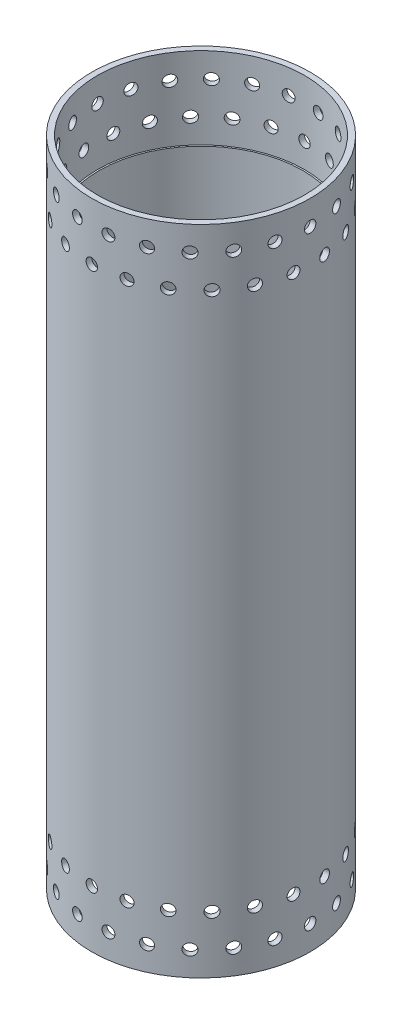
from build123d import *

# Parameters (mm, degrees)
SKETCH1_R                     = 67
SKETCH1_R_2                   = 62.5
BOSS_EXTRUDE1_DEPTH           = 400
CUT_EXTRUDE1_START            = -50
SKETCH2_R                     = 63.5
SKETCH2_R_2                   = 62.5
CUT_EXTRUDE1_DEPTH            = 50
F_7_0_7_DIAMETER_HOLE1_REACH  = 429.136
F_7_0_7_DIAMETER_HOLE1_BORE_R = 3.5
CIRPATTERN1_COUNT             = 22
F_7_0_7_DIAMETER_HOLE2_REACH  = 430.522
F_7_0_7_DIAMETER_HOLE2_BORE_R = 3.5
CIRPATTERN2_COUNT             = 22
MIRROR1_COPY_1_REACH          = 429.136
MIRROR1_COPY_1_SKETCH_R       = 3.5
MIRROR1_COPY_2_REACH          = 429.136
MIRROR1_COPY_2_SKETCH_R       = 3.5
MIRROR1_COPY_3_REACH          = 429.136
MIRROR1_COPY_3_SKETCH_R       = 3.5
MIRROR1_COPY_4_REACH          = 429.136
MIRROR1_COPY_4_SKETCH_R       = 3.5
MIRROR1_COPY_5_REACH          = 429.136
MIRROR1_COPY_5_SKETCH_R       = 3.5
MIRROR1_COPY_6_REACH          = 429.136
MIRROR1_COPY_6_SKETCH_R       = 3.5
MIRROR1_COPY_7_REACH          = 429.136
MIRROR1_COPY_7_SKETCH_R       = 3.5
MIRROR1_COPY_8_REACH          = 429.136
MIRROR1_COPY_8_SKETCH_R       = 3.5
MIRROR1_COPY_9_REACH          = 429.136
MIRROR1_COPY_9_SKETCH_R       = 3.5
MIRROR1_COPY_10_REACH         = 429.136
MIRROR1_COPY_10_SKETCH_R      = 3.5
MIRROR1_COPY_11_REACH         = 429.136
MIRROR1_COPY_11_SKETCH_R      = 3.5
MIRROR1_COPY_12_REACH         = 429.136
MIRROR1_COPY_12_SKETCH_R      = 3.5
MIRROR1_COPY_13_REACH         = 429.136
MIRROR1_COPY_13_SKETCH_R      = 3.5
MIRROR1_COPY_14_REACH         = 429.136
MIRROR1_COPY_14_SKETCH_R      = 3.5
MIRROR1_COPY_15_REACH         = 429.136
MIRROR1_COPY_15_SKETCH_R      = 3.5
MIRROR1_COPY_16_REACH         = 429.136
MIRROR1_COPY_16_SKETCH_R      = 3.5
MIRROR1_COPY_17_REACH         = 429.136
MIRROR1_COPY_17_SKETCH_R      = 3.5
MIRROR1_COPY_18_REACH         = 429.136
MIRROR1_COPY_18_SKETCH_R      = 3.5
MIRROR1_COPY_19_REACH         = 429.136
MIRROR1_COPY_19_SKETCH_R      = 3.5
MIRROR1_COPY_20_REACH         = 429.136
MIRROR1_COPY_20_SKETCH_R      = 3.5
MIRROR1_COPY_21_REACH         = 429.136
MIRROR1_COPY_21_SKETCH_R      = 3.5
MIRROR1_COPY_22_REACH         = 430.522
MIRROR1_COPY_22_SKETCH_R      = 3.5
MIRROR1_COPY_23_REACH         = 430.522
MIRROR1_COPY_23_SKETCH_R      = 3.5
MIRROR1_COPY_24_REACH         = 430.522
MIRROR1_COPY_24_SKETCH_R      = 3.5
MIRROR1_COPY_25_REACH         = 430.522
MIRROR1_COPY_25_SKETCH_R      = 3.5
MIRROR1_COPY_26_REACH         = 430.522
MIRROR1_COPY_26_SKETCH_R      = 3.5
MIRROR1_COPY_27_REACH         = 430.522
MIRROR1_COPY_27_SKETCH_R      = 3.5
MIRROR1_COPY_28_REACH         = 430.522
MIRROR1_COPY_28_SKETCH_R      = 3.5
MIRROR1_COPY_29_REACH         = 430.522
MIRROR1_COPY_29_SKETCH_R      = 3.5
MIRROR1_COPY_30_REACH         = 430.522
MIRROR1_COPY_30_SKETCH_R      = 3.5
MIRROR1_COPY_31_REACH         = 430.522
MIRROR1_COPY_31_SKETCH_R      = 3.5
MIRROR1_COPY_32_REACH         = 430.522
MIRROR1_COPY_32_SKETCH_R      = 3.5
MIRROR1_COPY_33_REACH         = 430.522
MIRROR1_COPY_33_SKETCH_R      = 3.5
MIRROR1_COPY_34_REACH         = 430.522
MIRROR1_COPY_34_SKETCH_R      = 3.5
MIRROR1_COPY_35_REACH         = 430.522
MIRROR1_COPY_35_SKETCH_R      = 3.5
MIRROR1_COPY_36_REACH         = 430.522
MIRROR1_COPY_36_SKETCH_R      = 3.5
MIRROR1_COPY_37_REACH         = 430.522
MIRROR1_COPY_37_SKETCH_R      = 3.5
MIRROR1_COPY_38_REACH         = 430.522
MIRROR1_COPY_38_SKETCH_R      = 3.5
MIRROR1_COPY_39_REACH         = 430.522
MIRROR1_COPY_39_SKETCH_R      = 3.5
MIRROR1_COPY_40_REACH         = 430.522
MIRROR1_COPY_40_SKETCH_R      = 3.5
MIRROR1_COPY_41_REACH         = 430.522
MIRROR1_COPY_41_SKETCH_R      = 3.5
MIRROR1_COPY_42_REACH         = 430.522
MIRROR1_COPY_42_SKETCH_R      = 3.5


with BuildPart() as part:
    # Sketch1 → Boss-Extrude1 (new body)
    with BuildSketch(Plane(origin=(0, 0, 0), x_dir=(1, 0, 0), z_dir=(0, 1, 0))):
        with Locations(Location((0, 0, 0), (0, 0, 270))):
            Circle(SKETCH1_R)
        with Locations(Location((0, 0, 0), (0, 0, 270))):
            Circle(SKETCH1_R_2, mode=Mode.SUBTRACT)
    extrude(amount=BOSS_EXTRUDE1_DEPTH)

    # Sketch2 → Cut-Extrude1 (cut)
    with BuildSketch(Plane(origin=(0, 400, 0), x_dir=(1, 0, 0), z_dir=(0, 1, 0)).offset(CUT_EXTRUDE1_START)):
        with Locations(Location((0, 0, 0), (0, 0, 270))):
            Circle(SKETCH2_R)
        with Locations(Location((0, 0, 0), (0, 0, 270))):
            Circle(SKETCH2_R_2, mode=Mode.SUBTRACT)
    cut_extrude1 = extrude(amount=CUT_EXTRUDE1_DEPTH, mode=Mode.SUBTRACT)

    # Ø7.0 (7) Diameter Hole1 bore → Ø7.0 (7) Diameter Hole1 (cut, up to next)
    with BuildSketch(Plane.ZY.offset(67), mode=Mode.PRIVATE) as f_7_0_7_diameter_hole1_sk1:
        with Locations((0, 385)):
            Circle(F_7_0_7_DIAMETER_HOLE1_BORE_R)
    f_7_0_7_diameter_hole1_tool1 = extrude(f_7_0_7_diameter_hole1_sk1.sketch, amount=-F_7_0_7_DIAMETER_HOLE1_REACH, mode=Mode.PRIVATE) & part.part
    f_7_0_7_diameter_hole1 = f_7_0_7_diameter_hole1_tool1.solids().sort_by_distance((-67, 385, 0))[0]
    add(f_7_0_7_diameter_hole1, mode=Mode.SUBTRACT)

    # CirPattern1: Ø7.0 (7) Diameter Hole1 ×22 about axis
    cirpattern1_axis = Axis((0, 400, 0), (0, -1, 0))
    for i in range(1, CIRPATTERN1_COUNT):
        add(f_7_0_7_diameter_hole1.rotate(cirpattern1_axis, i * 360 / CIRPATTERN1_COUNT), mode=Mode.SUBTRACT)

    # Ø7.0 (7) Diameter Hole2 bore → Ø7.0 (7) Diameter Hole2 (cut, up to next)
    with BuildSketch(Plane(origin=(66.318036606, 0, 9.535094162), x_dir=(0, -1, 0), z_dir=(0.9898214418854488, 0, 0.1423148382418752)), mode=Mode.PRIVATE) as f_7_0_7_diameter_hole2_sk1:
        with Locations((-365, 0)):
            Circle(F_7_0_7_DIAMETER_HOLE2_BORE_R)
    f_7_0_7_diameter_hole2_tool1 = extrude(f_7_0_7_diameter_hole2_sk1.sketch, amount=-F_7_0_7_DIAMETER_HOLE2_REACH, mode=Mode.PRIVATE) & part.part
    f_7_0_7_diameter_hole2 = f_7_0_7_diameter_hole2_tool1.solids().sort_by_distance((66.318037, 365, 9.535094))[0]
    add(f_7_0_7_diameter_hole2, mode=Mode.SUBTRACT)

    # CirPattern2: Ø7.0 (7) Diameter Hole2 ×22 about axis
    cirpattern2_axis = Axis((0, 400, 0), (0, -1, 0))
    for i in range(1, CIRPATTERN2_COUNT):
        add(f_7_0_7_diameter_hole2.rotate(cirpattern2_axis, i * 360 / CIRPATTERN2_COUNT), mode=Mode.SUBTRACT)

    # Mirror1: Cut-Extrude1, Ø7.0 (7) Diameter Hole1, Ø7.0 (7) Diameter Hole2 across plane
    add(cut_extrude1.mirror(Plane.ZX.offset(200)), mode=Mode.SUBTRACT)
    add(f_7_0_7_diameter_hole1.mirror(Plane.ZX.offset(200)), mode=Mode.SUBTRACT)
    add(f_7_0_7_diameter_hole2.mirror(Plane.ZX.offset(200)), mode=Mode.SUBTRACT)

    # Mirror1 copy 1 sketch → Mirror1 copy 1 (cut, up to next)
    with BuildSketch(Plane(origin=(-64.286029232, 400, -18.876081308), x_dir=(-0.28173255684142967, 0, 0.9594929736144974), z_dir=(-0.9594929736144974, 0, -0.28173255684142967)), mode=Mode.PRIVATE) as mirror1_copy_1_sk1:
        with Locations((0, -385)):
            Circle(MIRROR1_COPY_1_SKETCH_R)
    mirror1_copy_1_tool1 = extrude(mirror1_copy_1_sk1.sketch, amount=-MIRROR1_COPY_1_REACH, mode=Mode.PRIVATE) & part.part
    add(mirror1_copy_1_tool1.solids().sort_by_distance((-64.286029232, 15, -18.876081308))[0], mode=Mode.SUBTRACT)

    # Mirror1 copy 2 sketch → Mirror1 copy 2 (cut, up to next)
    with BuildSketch(Plane(origin=(-56.3639867, 400, -36.22293477), x_dir=(-0.5406408174555976, 0, 0.8412535328311812), z_dir=(-0.8412535328311812, 0, -0.5406408174555976)), mode=Mode.PRIVATE) as mirror1_copy_2_sk1:
        with Locations((0, -385)):
            Circle(MIRROR1_COPY_2_SKETCH_R)
    mirror1_copy_2_tool1 = extrude(mirror1_copy_2_sk1.sketch, amount=-MIRROR1_COPY_2_REACH, mode=Mode.PRIVATE) & part.part
    add(mirror1_copy_2_tool1.solids().sort_by_distance((-56.3639867, 15, -36.22293477))[0], mode=Mode.SUBTRACT)

    # Mirror1 copy 3 sketch → Mirror1 copy 3 (cut, up to next)
    with BuildSketch(Plane(origin=(-43.875669174, 400, -50.635221482), x_dir=(-0.7557495743542583, 0, 0.654860733945285), z_dir=(-0.654860733945285, 0, -0.7557495743542583)), mode=Mode.PRIVATE) as mirror1_copy_3_sk1:
        with Locations((0, -385)):
            Circle(MIRROR1_COPY_3_SKETCH_R)
    mirror1_copy_3_tool1 = extrude(mirror1_copy_3_sk1.sketch, amount=-MIRROR1_COPY_3_REACH, mode=Mode.PRIVATE) & part.part
    add(mirror1_copy_3_tool1.solids().sort_by_distance((-43.875669174, 15, -50.635221482))[0], mode=Mode.SUBTRACT)

    # Mirror1 copy 4 sketch → Mirror1 copy 4 (cut, up to next)
    with BuildSketch(Plane(origin=(-27.832805871, 400, -60.945343689), x_dir=(-0.9096319953545183, 0, 0.41541501300188644), z_dir=(-0.41541501300188644, 0, -0.9096319953545183)), mode=Mode.PRIVATE) as mirror1_copy_4_sk1:
        with Locations((0, -385)):
            Circle(MIRROR1_COPY_4_SKETCH_R)
    mirror1_copy_4_tool1 = extrude(mirror1_copy_4_sk1.sketch, amount=-MIRROR1_COPY_4_REACH, mode=Mode.PRIVATE) & part.part
    add(mirror1_copy_4_tool1.solids().sort_by_distance((-27.832805871, 15, -60.945343689))[0], mode=Mode.SUBTRACT)

    # Mirror1 copy 5 sketch → Mirror1 copy 5 (cut, up to next)
    with BuildSketch(Plane(origin=(-9.535094164, 400, -66.318036606), x_dir=(-0.9898214418809327, 0, 0.14231483827328534), z_dir=(-0.14231483827328534, 0, -0.9898214418809327)), mode=Mode.PRIVATE) as mirror1_copy_5_sk1:
        with Locations((0, -385)):
            Circle(MIRROR1_COPY_5_SKETCH_R)
    mirror1_copy_5_tool1 = extrude(mirror1_copy_5_sk1.sketch, amount=-MIRROR1_COPY_5_REACH, mode=Mode.PRIVATE) & part.part
    add(mirror1_copy_5_tool1.solids().sort_by_distance((-9.535094164, 15, -66.318036606))[0], mode=Mode.SUBTRACT)

    # Mirror1 copy 6 sketch → Mirror1 copy 6 (cut, up to next)
    with BuildSketch(Plane(origin=(9.535094164, 400, -66.318036606), x_dir=(-0.9898214418809327, 0, -0.14231483827328523), z_dir=(0.14231483827328523, 0, -0.9898214418809327)), mode=Mode.PRIVATE) as mirror1_copy_6_sk1:
        with Locations((0, -385)):
            Circle(MIRROR1_COPY_6_SKETCH_R)
    mirror1_copy_6_tool1 = extrude(mirror1_copy_6_sk1.sketch, amount=-MIRROR1_COPY_6_REACH, mode=Mode.PRIVATE) & part.part
    add(mirror1_copy_6_tool1.solids().sort_by_distance((9.535094164, 15, -66.318036606))[0], mode=Mode.SUBTRACT)

    # Mirror1 copy 7 sketch → Mirror1 copy 7 (cut, up to next)
    with BuildSketch(Plane(origin=(27.832805871, 400, -60.945343689), x_dir=(-0.9096319953545184, 0, -0.4154150130018863), z_dir=(0.4154150130018863, 0, -0.9096319953545184)), mode=Mode.PRIVATE) as mirror1_copy_7_sk1:
        with Locations((0, -385)):
            Circle(MIRROR1_COPY_7_SKETCH_R)
    mirror1_copy_7_tool1 = extrude(mirror1_copy_7_sk1.sketch, amount=-MIRROR1_COPY_7_REACH, mode=Mode.PRIVATE) & part.part
    add(mirror1_copy_7_tool1.solids().sort_by_distance((27.832805871, 15, -60.945343689))[0], mode=Mode.SUBTRACT)

    # Mirror1 copy 8 sketch → Mirror1 copy 8 (cut, up to next)
    with BuildSketch(Plane(origin=(43.875669174, 400, -50.635221482), x_dir=(-0.7557495743542583, 0, -0.654860733945285), z_dir=(0.654860733945285, 0, -0.7557495743542583)), mode=Mode.PRIVATE) as mirror1_copy_8_sk1:
        with Locations((0, -385)):
            Circle(MIRROR1_COPY_8_SKETCH_R)
    mirror1_copy_8_tool1 = extrude(mirror1_copy_8_sk1.sketch, amount=-MIRROR1_COPY_8_REACH, mode=Mode.PRIVATE) & part.part
    add(mirror1_copy_8_tool1.solids().sort_by_distance((43.875669174, 15, -50.635221482))[0], mode=Mode.SUBTRACT)

    # Mirror1 copy 9 sketch → Mirror1 copy 9 (cut, up to next)
    with BuildSketch(Plane(origin=(56.3639867, 400, -36.22293477), x_dir=(-0.5406408174555974, 0, -0.8412535328311813), z_dir=(0.8412535328311813, 0, -0.5406408174555974)), mode=Mode.PRIVATE) as mirror1_copy_9_sk1:
        with Locations((0, -385)):
            Circle(MIRROR1_COPY_9_SKETCH_R)
    mirror1_copy_9_tool1 = extrude(mirror1_copy_9_sk1.sketch, amount=-MIRROR1_COPY_9_REACH, mode=Mode.PRIVATE) & part.part
    add(mirror1_copy_9_tool1.solids().sort_by_distance((56.3639867, 15, -36.22293477))[0], mode=Mode.SUBTRACT)

    # Mirror1 copy 10 sketch → Mirror1 copy 10 (cut, up to next)
    with BuildSketch(Plane(origin=(64.286029232, 400, -18.876081308), x_dir=(-0.28173255684143006, 0, -0.9594929736144973), z_dir=(0.9594929736144973, 0, -0.28173255684143006)), mode=Mode.PRIVATE) as mirror1_copy_10_sk1:
        with Locations((0, -385)):
            Circle(MIRROR1_COPY_10_SKETCH_R)
    mirror1_copy_10_tool1 = extrude(mirror1_copy_10_sk1.sketch, amount=-MIRROR1_COPY_10_REACH, mode=Mode.PRIVATE) & part.part
    add(mirror1_copy_10_tool1.solids().sort_by_distance((64.286029232, 15, -18.876081308))[0], mode=Mode.SUBTRACT)

    # Mirror1 copy 11 sketch → Mirror1 copy 11 (cut, up to next)
    with BuildSketch(Plane(origin=(67, 400, 0), x_dir=(0, 0, -1), z_dir=(1, 0, 0)), mode=Mode.PRIVATE) as mirror1_copy_11_sk1:
        with Locations((0, -385)):
            Circle(MIRROR1_COPY_11_SKETCH_R)
    mirror1_copy_11_tool1 = extrude(mirror1_copy_11_sk1.sketch, amount=-MIRROR1_COPY_11_REACH, mode=Mode.PRIVATE) & part.part
    add(mirror1_copy_11_tool1.solids().sort_by_distance((67, 15, 0))[0], mode=Mode.SUBTRACT)

    # Mirror1 copy 12 sketch → Mirror1 copy 12 (cut, up to next)
    with BuildSketch(Plane(origin=(64.286029232, 400, 18.876081308), x_dir=(0.28173255684142984, 0, -0.9594929736144974), z_dir=(0.9594929736144974, 0, 0.28173255684142984)), mode=Mode.PRIVATE) as mirror1_copy_12_sk1:
        with Locations((0, -385)):
            Circle(MIRROR1_COPY_12_SKETCH_R)
    mirror1_copy_12_tool1 = extrude(mirror1_copy_12_sk1.sketch, amount=-MIRROR1_COPY_12_REACH, mode=Mode.PRIVATE) & part.part
    add(mirror1_copy_12_tool1.solids().sort_by_distance((64.286029232, 15, 18.876081308))[0], mode=Mode.SUBTRACT)

    # Mirror1 copy 13 sketch → Mirror1 copy 13 (cut, up to next)
    with BuildSketch(Plane(origin=(56.3639867, 400, 36.22293477), x_dir=(0.5406408174555976, 0, -0.8412535328311812), z_dir=(0.8412535328311812, 0, 0.5406408174555976)), mode=Mode.PRIVATE) as mirror1_copy_13_sk1:
        with Locations((0, -385)):
            Circle(MIRROR1_COPY_13_SKETCH_R)
    mirror1_copy_13_tool1 = extrude(mirror1_copy_13_sk1.sketch, amount=-MIRROR1_COPY_13_REACH, mode=Mode.PRIVATE) & part.part
    add(mirror1_copy_13_tool1.solids().sort_by_distance((56.3639867, 15, 36.22293477))[0], mode=Mode.SUBTRACT)

    # Mirror1 copy 14 sketch → Mirror1 copy 14 (cut, up to next)
    with BuildSketch(Plane(origin=(43.875669174, 400, 50.635221482), x_dir=(0.7557495743542582, 0, -0.6548607339452852), z_dir=(0.6548607339452852, 0, 0.7557495743542582)), mode=Mode.PRIVATE) as mirror1_copy_14_sk1:
        with Locations((0, -385)):
            Circle(MIRROR1_COPY_14_SKETCH_R)
    mirror1_copy_14_tool1 = extrude(mirror1_copy_14_sk1.sketch, amount=-MIRROR1_COPY_14_REACH, mode=Mode.PRIVATE) & part.part
    add(mirror1_copy_14_tool1.solids().sort_by_distance((43.875669174, 15, 50.635221482))[0], mode=Mode.SUBTRACT)

    # Mirror1 copy 15 sketch → Mirror1 copy 15 (cut, up to next)
    with BuildSketch(Plane(origin=(27.832805871, 400, 60.945343689), x_dir=(0.9096319953545184, 0, -0.4154150130018864), z_dir=(0.4154150130018864, 0, 0.9096319953545184)), mode=Mode.PRIVATE) as mirror1_copy_15_sk1:
        with Locations((0, -385)):
            Circle(MIRROR1_COPY_15_SKETCH_R)
    mirror1_copy_15_tool1 = extrude(mirror1_copy_15_sk1.sketch, amount=-MIRROR1_COPY_15_REACH, mode=Mode.PRIVATE) & part.part
    add(mirror1_copy_15_tool1.solids().sort_by_distance((27.832805871, 15, 60.945343689))[0], mode=Mode.SUBTRACT)

    # Mirror1 copy 16 sketch → Mirror1 copy 16 (cut, up to next)
    with BuildSketch(Plane(origin=(9.535094164, 400, 66.318036606), x_dir=(0.9898214418809327, 0, -0.14231483827328523), z_dir=(0.14231483827328523, 0, 0.9898214418809327)), mode=Mode.PRIVATE) as mirror1_copy_16_sk1:
        with Locations((0, -385)):
            Circle(MIRROR1_COPY_16_SKETCH_R)
    mirror1_copy_16_tool1 = extrude(mirror1_copy_16_sk1.sketch, amount=-MIRROR1_COPY_16_REACH, mode=Mode.PRIVATE) & part.part
    add(mirror1_copy_16_tool1.solids().sort_by_distance((9.535094164, 15, 66.318036606))[0], mode=Mode.SUBTRACT)

    # Mirror1 copy 17 sketch → Mirror1 copy 17 (cut, up to next)
    with BuildSketch(Plane(origin=(-9.535094164, 400, 66.318036606), x_dir=(0.9898214418809328, 0, 0.14231483827328487), z_dir=(-0.14231483827328487, 0, 0.9898214418809328)), mode=Mode.PRIVATE) as mirror1_copy_17_sk1:
        with Locations((0, -385)):
            Circle(MIRROR1_COPY_17_SKETCH_R)
    mirror1_copy_17_tool1 = extrude(mirror1_copy_17_sk1.sketch, amount=-MIRROR1_COPY_17_REACH, mode=Mode.PRIVATE) & part.part
    add(mirror1_copy_17_tool1.solids().sort_by_distance((-9.535094164, 15, 66.318036606))[0], mode=Mode.SUBTRACT)

    # Mirror1 copy 18 sketch → Mirror1 copy 18 (cut, up to next)
    with BuildSketch(Plane(origin=(-27.832805871, 400, 60.945343689), x_dir=(0.9096319953545182, 0, 0.4154150130018868), z_dir=(-0.4154150130018868, 0, 0.9096319953545182)), mode=Mode.PRIVATE) as mirror1_copy_18_sk1:
        with Locations((0, -385)):
            Circle(MIRROR1_COPY_18_SKETCH_R)
    mirror1_copy_18_tool1 = extrude(mirror1_copy_18_sk1.sketch, amount=-MIRROR1_COPY_18_REACH, mode=Mode.PRIVATE) & part.part
    add(mirror1_copy_18_tool1.solids().sort_by_distance((-27.832805871, 15, 60.945343689))[0], mode=Mode.SUBTRACT)

    # Mirror1 copy 19 sketch → Mirror1 copy 19 (cut, up to next)
    with BuildSketch(Plane(origin=(-43.875669174, 400, 50.635221482), x_dir=(0.7557495743542587, 0, 0.6548607339452845), z_dir=(-0.6548607339452845, 0, 0.7557495743542587)), mode=Mode.PRIVATE) as mirror1_copy_19_sk1:
        with Locations((0, -385)):
            Circle(MIRROR1_COPY_19_SKETCH_R)
    mirror1_copy_19_tool1 = extrude(mirror1_copy_19_sk1.sketch, amount=-MIRROR1_COPY_19_REACH, mode=Mode.PRIVATE) & part.part
    add(mirror1_copy_19_tool1.solids().sort_by_distance((-43.875669174, 15, 50.635221482))[0], mode=Mode.SUBTRACT)

    # Mirror1 copy 20 sketch → Mirror1 copy 20 (cut, up to next)
    with BuildSketch(Plane(origin=(-56.3639867, 400, 36.22293477), x_dir=(0.5406408174555982, 0, 0.8412535328311808), z_dir=(-0.8412535328311808, 0, 0.5406408174555982)), mode=Mode.PRIVATE) as mirror1_copy_20_sk1:
        with Locations((0, -385)):
            Circle(MIRROR1_COPY_20_SKETCH_R)
    mirror1_copy_20_tool1 = extrude(mirror1_copy_20_sk1.sketch, amount=-MIRROR1_COPY_20_REACH, mode=Mode.PRIVATE) & part.part
    add(mirror1_copy_20_tool1.solids().sort_by_distance((-56.3639867, 15, 36.22293477))[0], mode=Mode.SUBTRACT)

    # Mirror1 copy 21 sketch → Mirror1 copy 21 (cut, up to next)
    with BuildSketch(Plane(origin=(-64.286029232, 400, 18.876081308), x_dir=(0.2817325568414298, 0, 0.9594929736144974), z_dir=(-0.9594929736144974, 0, 0.2817325568414298)), mode=Mode.PRIVATE) as mirror1_copy_21_sk1:
        with Locations((0, -385)):
            Circle(MIRROR1_COPY_21_SKETCH_R)
    mirror1_copy_21_tool1 = extrude(mirror1_copy_21_sk1.sketch, amount=-MIRROR1_COPY_21_REACH, mode=Mode.PRIVATE) & part.part
    add(mirror1_copy_21_tool1.solids().sort_by_distance((-64.286029232, 15, 18.876081308))[0], mode=Mode.SUBTRACT)

    # Mirror1 copy 22 sketch → Mirror1 copy 22 (cut, up to next)
    with BuildSketch(Plane(origin=(60.94534369, 400, 27.832805869), x_dir=(0, 1, 0), z_dir=(0.9096319953677008, 0, 0.4154150129730212)), mode=Mode.PRIVATE) as mirror1_copy_22_sk1:
        with Locations((-365, 0)):
            Circle(MIRROR1_COPY_22_SKETCH_R)
    mirror1_copy_22_tool1 = extrude(mirror1_copy_22_sk1.sketch, amount=-MIRROR1_COPY_22_REACH, mode=Mode.PRIVATE) & part.part
    add(mirror1_copy_22_tool1.solids().sort_by_distance((60.945344113, 35, 27.832805824))[0], mode=Mode.SUBTRACT)

    # Mirror1 copy 23 sketch → Mirror1 copy 23 (cut, up to next)
    with BuildSketch(Plane(origin=(50.635221483, 400, 43.875669173), x_dir=(0, 1, 0), z_dir=(0.7557495743750391, 0, 0.654860733921303)), mode=Mode.PRIVATE) as mirror1_copy_23_sk1:
        with Locations((-365, 0)):
            Circle(MIRROR1_COPY_23_SKETCH_R)
    mirror1_copy_23_tool1 = extrude(mirror1_copy_23_sk1.sketch, amount=-MIRROR1_COPY_23_REACH, mode=Mode.PRIVATE) & part.part
    add(mirror1_copy_23_tool1.solids().sort_by_distance((50.635221902, 35, 43.875669249))[0], mode=Mode.SUBTRACT)

    # Mirror1 copy 24 sketch → Mirror1 copy 24 (cut, up to next)
    with BuildSketch(Plane(origin=(36.222934771, 400, 56.363986699), x_dir=(0, 1, 0), z_dir=(0.540640817482293, 0, 0.841253532814025)), mode=Mode.PRIVATE) as mirror1_copy_24_sk1:
        with Locations((-365, 0)):
            Circle(MIRROR1_COPY_24_SKETCH_R)
    mirror1_copy_24_tool1 = extrude(mirror1_copy_24_sk1.sketch, amount=-MIRROR1_COPY_24_REACH, mode=Mode.PRIVATE) & part.part
    add(mirror1_copy_24_tool1.solids().sort_by_distance((36.222935152, 35, 56.36398689))[0], mode=Mode.SUBTRACT)

    # Mirror1 copy 25 sketch → Mirror1 copy 25 (cut, up to next)
    with BuildSketch(Plane(origin=(18.87608131, 400, 64.286029232), x_dir=(0, 1, 0), z_dir=(0.28173255687187726, 0, 0.9594929736055572)), mode=Mode.PRIVATE) as mirror1_copy_25_sk1:
        with Locations((-365, 0)):
            Circle(MIRROR1_COPY_25_SKETCH_R)
    mirror1_copy_25_tool1 = extrude(mirror1_copy_25_sk1.sketch, amount=-MIRROR1_COPY_25_REACH, mode=Mode.PRIVATE) & part.part
    add(mirror1_copy_25_tool1.solids().sort_by_distance((18.876081622, 35, 64.286029522))[0], mode=Mode.SUBTRACT)

    # Mirror1 copy 26 sketch → Mirror1 copy 26 (cut, up to next)
    with BuildSketch(Plane(origin=(2e-09, 400, 67), x_dir=(0, 1, 0), z_dir=(3.1733143890377846e-11, 0, 1.0)), mode=Mode.PRIVATE) as mirror1_copy_26_sk1:
        with Locations((-365, 0)):
            Circle(MIRROR1_COPY_26_SKETCH_R)
    mirror1_copy_26_tool1 = extrude(mirror1_copy_26_sk1.sketch, amount=-MIRROR1_COPY_26_REACH, mode=Mode.PRIVATE) & part.part
    add(mirror1_copy_26_tool1.solids().sort_by_distance((2.19e-07, 35, 67.000000367))[0], mode=Mode.SUBTRACT)

    # Mirror1 copy 27 sketch → Mirror1 copy 27 (cut, up to next)
    with BuildSketch(Plane(origin=(-18.876081306, 400, 64.286029233), x_dir=(0, 1, 0), z_dir=(-0.2817325568109823, 0, 0.9594929736234377)), mode=Mode.PRIVATE) as mirror1_copy_27_sk1:
        with Locations((-365, 0)):
            Circle(MIRROR1_COPY_27_SKETCH_R)
    mirror1_copy_27_tool1 = extrude(mirror1_copy_27_sk1.sketch, amount=-MIRROR1_COPY_27_REACH, mode=Mode.PRIVATE) & part.part
    add(mirror1_copy_27_tool1.solids().sort_by_distance((-18.876081202, 35, 64.286029646))[0], mode=Mode.SUBTRACT)

    # Mirror1 copy 28 sketch → Mirror1 copy 28 (cut, up to next)
    with BuildSketch(Plane(origin=(-36.222934768, 400, 56.363986701), x_dir=(0, 1, 0), z_dir=(-0.540640817428902, 0, 0.8412535328483375)), mode=Mode.PRIVATE) as mirror1_copy_28_sk1:
        with Locations((-365, 0)):
            Circle(MIRROR1_COPY_28_SKETCH_R)
    mirror1_copy_28_tool1 = extrude(mirror1_copy_28_sk1.sketch, amount=-MIRROR1_COPY_28_REACH, mode=Mode.PRIVATE) & part.part
    add(mirror1_copy_28_tool1.solids().sort_by_distance((-36.222934784, 35, 56.363987126))[0], mode=Mode.SUBTRACT)

    # Mirror1 copy 29 sketch → Mirror1 copy 29 (cut, up to next)
    with BuildSketch(Plane(origin=(-50.63522148, 400, 43.875669176), x_dir=(0, 1, 0), z_dir=(-0.7557495743334777, 0, 0.6548607339692673)), mode=Mode.PRIVATE) as mirror1_copy_29_sk1:
        with Locations((-365, 0)):
            Circle(MIRROR1_COPY_29_SKETCH_R)
    mirror1_copy_29_tool1 = extrude(mirror1_copy_29_sk1.sketch, amount=-MIRROR1_COPY_29_REACH, mode=Mode.PRIVATE) & part.part
    add(mirror1_copy_29_tool1.solids().sort_by_distance((-50.635221616, 35, 43.87566958))[0], mode=Mode.SUBTRACT)

    # Mirror1 copy 30 sketch → Mirror1 copy 30 (cut, up to next)
    with BuildSketch(Plane(origin=(-60.945343688, 400, 27.832805873), x_dir=(0, 1, 0), z_dir=(-0.9096319953413362, 0, 0.4154150130307516)), mode=Mode.PRIVATE) as mirror1_copy_30_sk1:
        with Locations((-365, 0)):
            Circle(MIRROR1_COPY_30_SKETCH_R)
    mirror1_copy_30_tool1 = extrude(mirror1_copy_30_sk1.sketch, amount=-MIRROR1_COPY_30_REACH, mode=Mode.PRIVATE) & part.part
    add(mirror1_copy_30_tool1.solids().sort_by_distance((-60.945343931, 35, 27.832806222))[0], mode=Mode.SUBTRACT)

    # Mirror1 copy 31 sketch → Mirror1 copy 31 (cut, up to next)
    with BuildSketch(Plane(origin=(-66.318036606, 400, 9.535094166), x_dir=(0, 1, 0), z_dir=(-0.9898214418764166, 0, 0.14231483830469543)), mode=Mode.PRIVATE) as mirror1_copy_31_sk1:
        with Locations((-365, 0)):
            Circle(MIRROR1_COPY_31_SKETCH_R)
    mirror1_copy_31_tool1 = extrude(mirror1_copy_31_sk1.sketch, amount=-MIRROR1_COPY_31_REACH, mode=Mode.PRIVATE) & part.part
    add(mirror1_copy_31_tool1.solids().sort_by_distance((-66.318036938, 35, 9.535094433))[0], mode=Mode.SUBTRACT)

    # Mirror1 copy 32 sketch → Mirror1 copy 32 (cut, up to next)
    with BuildSketch(Plane(origin=(-66.318036606, 400, -9.535094162), x_dir=(0, 1, 0), z_dir=(-0.9898214418854488, 0, -0.1423148382418751)), mode=Mode.PRIVATE) as mirror1_copy_32_sk1:
        with Locations((-365, 0)):
            Circle(MIRROR1_COPY_32_SKETCH_R)
    mirror1_copy_32_tool1 = extrude(mirror1_copy_32_sk1.sketch, amount=-MIRROR1_COPY_32_REACH, mode=Mode.PRIVATE) & part.part
    add(mirror1_copy_32_tool1.solids().sort_by_distance((-66.318037, 35, -9.535094))[0], mode=Mode.SUBTRACT)

    # Mirror1 copy 33 sketch → Mirror1 copy 33 (cut, up to next)
    with BuildSketch(Plane(origin=(-60.94534369, 400, -27.832805869), x_dir=(0, 1, 0), z_dir=(-0.9096319953677007, 0, -0.4154150129730213)), mode=Mode.PRIVATE) as mirror1_copy_33_sk1:
        with Locations((-365, 0)):
            Circle(MIRROR1_COPY_33_SKETCH_R)
    mirror1_copy_33_tool1 = extrude(mirror1_copy_33_sk1.sketch, amount=-MIRROR1_COPY_33_REACH, mode=Mode.PRIVATE) & part.part
    add(mirror1_copy_33_tool1.solids().sort_by_distance((-60.945344113, 35, -27.832805824))[0], mode=Mode.SUBTRACT)

    # Mirror1 copy 34 sketch → Mirror1 copy 34 (cut, up to next)
    with BuildSketch(Plane(origin=(-50.635221483, 400, -43.875669173), x_dir=(0, 1, 0), z_dir=(-0.7557495743750391, 0, -0.654860733921303)), mode=Mode.PRIVATE) as mirror1_copy_34_sk1:
        with Locations((-365, 0)):
            Circle(MIRROR1_COPY_34_SKETCH_R)
    mirror1_copy_34_tool1 = extrude(mirror1_copy_34_sk1.sketch, amount=-MIRROR1_COPY_34_REACH, mode=Mode.PRIVATE) & part.part
    add(mirror1_copy_34_tool1.solids().sort_by_distance((-50.635221902, 35, -43.875669249))[0], mode=Mode.SUBTRACT)

    # Mirror1 copy 35 sketch → Mirror1 copy 35 (cut, up to next)
    with BuildSketch(Plane(origin=(-36.222934771, 400, -56.363986699), x_dir=(0, 1, 0), z_dir=(-0.5406408174822932, 0, -0.8412535328140249)), mode=Mode.PRIVATE) as mirror1_copy_35_sk1:
        with Locations((-365, 0)):
            Circle(MIRROR1_COPY_35_SKETCH_R)
    mirror1_copy_35_tool1 = extrude(mirror1_copy_35_sk1.sketch, amount=-MIRROR1_COPY_35_REACH, mode=Mode.PRIVATE) & part.part
    add(mirror1_copy_35_tool1.solids().sort_by_distance((-36.222935152, 35, -56.36398689))[0], mode=Mode.SUBTRACT)

    # Mirror1 copy 36 sketch → Mirror1 copy 36 (cut, up to next)
    with BuildSketch(Plane(origin=(-18.87608131, 400, -64.286029232), x_dir=(0, 1, 0), z_dir=(-0.28173255687187715, 0, -0.9594929736055573)), mode=Mode.PRIVATE) as mirror1_copy_36_sk1:
        with Locations((-365, 0)):
            Circle(MIRROR1_COPY_36_SKETCH_R)
    mirror1_copy_36_tool1 = extrude(mirror1_copy_36_sk1.sketch, amount=-MIRROR1_COPY_36_REACH, mode=Mode.PRIVATE) & part.part
    add(mirror1_copy_36_tool1.solids().sort_by_distance((-18.876081622, 35, -64.286029522))[0], mode=Mode.SUBTRACT)

    # Mirror1 copy 37 sketch → Mirror1 copy 37 (cut, up to next)
    with BuildSketch(Plane(origin=(-2e-09, 400, -67), x_dir=(0, 1, 0), z_dir=(-3.1733032868075384e-11, 0, -1.0)), mode=Mode.PRIVATE) as mirror1_copy_37_sk1:
        with Locations((-365, 0)):
            Circle(MIRROR1_COPY_37_SKETCH_R)
    mirror1_copy_37_tool1 = extrude(mirror1_copy_37_sk1.sketch, amount=-MIRROR1_COPY_37_REACH, mode=Mode.PRIVATE) & part.part
    add(mirror1_copy_37_tool1.solids().sort_by_distance((-2.19e-07, 35, -67.000000367))[0], mode=Mode.SUBTRACT)

    # Mirror1 copy 38 sketch → Mirror1 copy 38 (cut, up to next)
    with BuildSketch(Plane(origin=(18.876081306, 400, -64.286029233), x_dir=(0, 1, 0), z_dir=(0.28173255681098197, 0, -0.9594929736234378)), mode=Mode.PRIVATE) as mirror1_copy_38_sk1:
        with Locations((-365, 0)):
            Circle(MIRROR1_COPY_38_SKETCH_R)
    mirror1_copy_38_tool1 = extrude(mirror1_copy_38_sk1.sketch, amount=-MIRROR1_COPY_38_REACH, mode=Mode.PRIVATE) & part.part
    add(mirror1_copy_38_tool1.solids().sort_by_distance((18.876081202, 35, -64.286029646))[0], mode=Mode.SUBTRACT)

    # Mirror1 copy 39 sketch → Mirror1 copy 39 (cut, up to next)
    with BuildSketch(Plane(origin=(36.222934768, 400, -56.363986701), x_dir=(0, 1, 0), z_dir=(0.5406408174289026, 0, -0.8412535328483371)), mode=Mode.PRIVATE) as mirror1_copy_39_sk1:
        with Locations((-365, 0)):
            Circle(MIRROR1_COPY_39_SKETCH_R)
    mirror1_copy_39_tool1 = extrude(mirror1_copy_39_sk1.sketch, amount=-MIRROR1_COPY_39_REACH, mode=Mode.PRIVATE) & part.part
    add(mirror1_copy_39_tool1.solids().sort_by_distance((36.222934784, 35, -56.363987126))[0], mode=Mode.SUBTRACT)

    # Mirror1 copy 40 sketch → Mirror1 copy 40 (cut, up to next)
    with BuildSketch(Plane(origin=(50.63522148, 400, -43.875669176), x_dir=(0, 1, 0), z_dir=(0.7557495743334772, 0, -0.6548607339692677)), mode=Mode.PRIVATE) as mirror1_copy_40_sk1:
        with Locations((-365, 0)):
            Circle(MIRROR1_COPY_40_SKETCH_R)
    mirror1_copy_40_tool1 = extrude(mirror1_copy_40_sk1.sketch, amount=-MIRROR1_COPY_40_REACH, mode=Mode.PRIVATE) & part.part
    add(mirror1_copy_40_tool1.solids().sort_by_distance((50.635221616, 35, -43.87566958))[0], mode=Mode.SUBTRACT)

    # Mirror1 copy 41 sketch → Mirror1 copy 41 (cut, up to next)
    with BuildSketch(Plane(origin=(60.945343688, 400, -27.832805873), x_dir=(0, 1, 0), z_dir=(0.9096319953413358, 0, -0.41541501303075234)), mode=Mode.PRIVATE) as mirror1_copy_41_sk1:
        with Locations((-365, 0)):
            Circle(MIRROR1_COPY_41_SKETCH_R)
    mirror1_copy_41_tool1 = extrude(mirror1_copy_41_sk1.sketch, amount=-MIRROR1_COPY_41_REACH, mode=Mode.PRIVATE) & part.part
    add(mirror1_copy_41_tool1.solids().sort_by_distance((60.945343931, 35, -27.832806222))[0], mode=Mode.SUBTRACT)

    # Mirror1 copy 42 sketch → Mirror1 copy 42 (cut, up to next)
    with BuildSketch(Plane(origin=(66.318036606, 400, -9.535094166), x_dir=(0, 1, 0), z_dir=(0.9898214418764167, 0, -0.14231483830469518)), mode=Mode.PRIVATE) as mirror1_copy_42_sk1:
        with Locations((-365, 0)):
            Circle(MIRROR1_COPY_42_SKETCH_R)
    mirror1_copy_42_tool1 = extrude(mirror1_copy_42_sk1.sketch, amount=-MIRROR1_COPY_42_REACH, mode=Mode.PRIVATE) & part.part
    add(mirror1_copy_42_tool1.solids().sort_by_distance((66.318036938, 35, -9.535094433))[0], mode=Mode.SUBTRACT)


solid = part.part
